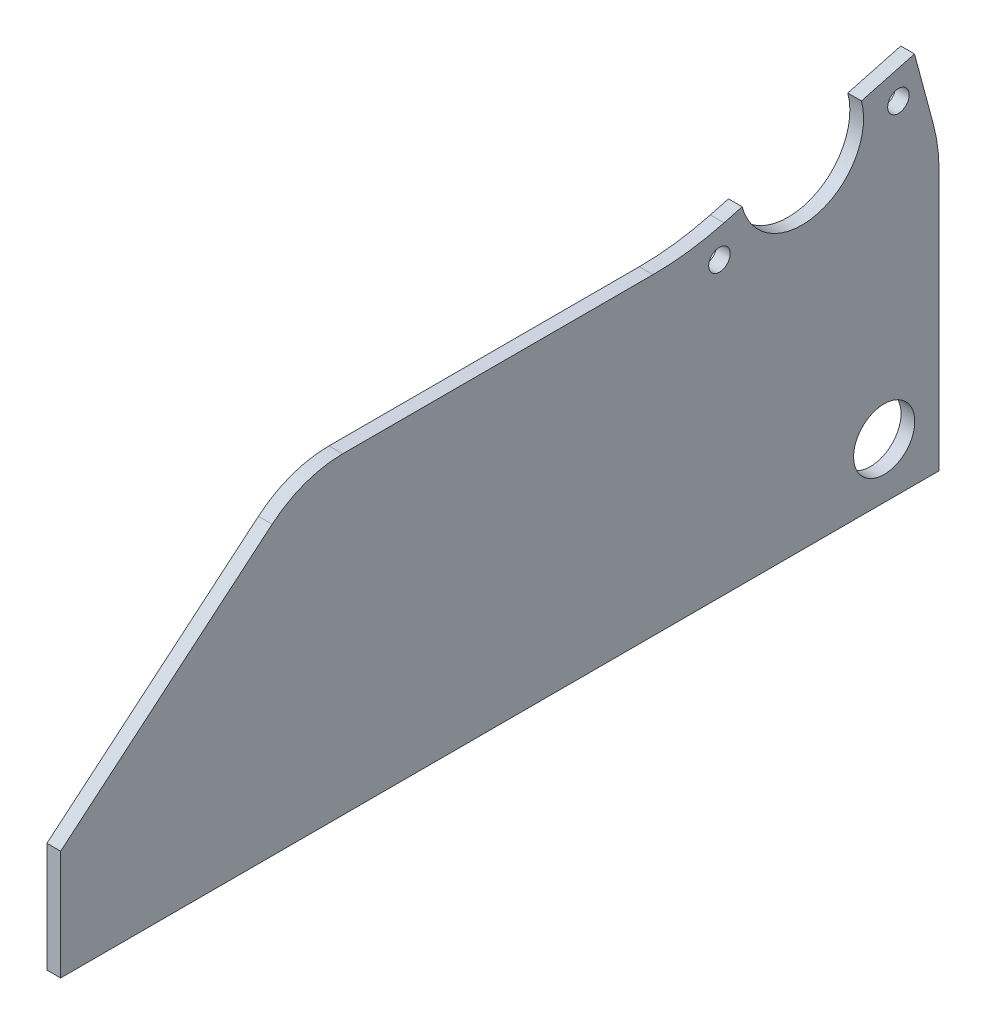
from build123d import *

# Parameters (mm, degrees)
BOSS_EXTRUDE1_DEPTH    = 3.175
F_10_CLEARANCE_HOLE1_D = 4.9784
SKETCH9_R              = 7.0739
CUT_EXTRUDE1_DEPTH     = 213.170750742
FILLET1_R              = 38.1
FILLET2_R              = 63.5


with BuildPart() as part:
    # Sketch1 → Boss-Extrude1 (new body)
    with BuildSketch(Plane(origin=(0, 0, 0), x_dir=(0, 0, -1), z_dir=(1, 0, 0))):
        with BuildLine():
            Line((0, -25.4), (0, 39.754079808))
            Line((0, 39.754079808), (-5.682076763, 60.95987898))
            Line((-5.682076763, 60.95987898), (-17.949334757, 57.672877107))
            ThreePointArc((-17.949334757, 57.672877107), (-28.052122893, 40.174334757), (-45.550665243, 50.277122893))
            Line((-45.550665243, 50.277122893), (-57.817923237, 46.99012102))
            Line((-57.817923237, 46.99012102), (-137.954510507, 46.99012102))
            ThreePointArc((-137.954510507, 46.99012102), (-146.641822148, 45.458313588), (-154.281315793, 41.047649876))
            Line((-154.281315793, 41.047649876), (-203.2, 0))
            Line((-203.2, 0), (-203.2, -25.4))
            Line((-203.2, -25.4), (0, -25.4))
        make_face()
    extrude(amount=BOSS_EXTRUDE1_DEPTH)

    # #10 Clearance Hole1 (through all)
    with Locations(Plane(origin=(3.175, 0, 0), x_dir=(0, 0, -1), z_dir=(1, 0, 0))):
        with Locations((-50.807496928, 42.294555343), (-9.405501199, 53.388186663)):
            Hole(F_10_CLEARANCE_HOLE1_D / 2)

    # Sketch9 → Cut-Extrude1 (cut, through all)
    with BuildSketch(Plane(origin=(3.175, 0, 0), x_dir=(0, 0, -1), z_dir=(1, 0, 0))):
        with Locations((-12.7, -12.7)):
            Circle(SKETCH9_R)
    extrude(amount=-CUT_EXTRUDE1_DEPTH, mode=Mode.SUBTRACT)

    # Fillet1
    fillet1_edges = [part.edges().sort_by_distance(p)[0] for p in [
        (1.5875, 39.754079808, 0),
    ]]
    fillet(fillet1_edges, radius=FILLET1_R)

    # Fillet2
    fillet2_edges = [part.edges().sort_by_distance(p)[0] for p in [
        (1.5875, 46.99012102, 57.817923237),
    ]]
    fillet(fillet2_edges, radius=FILLET2_R)


solid = part.part
